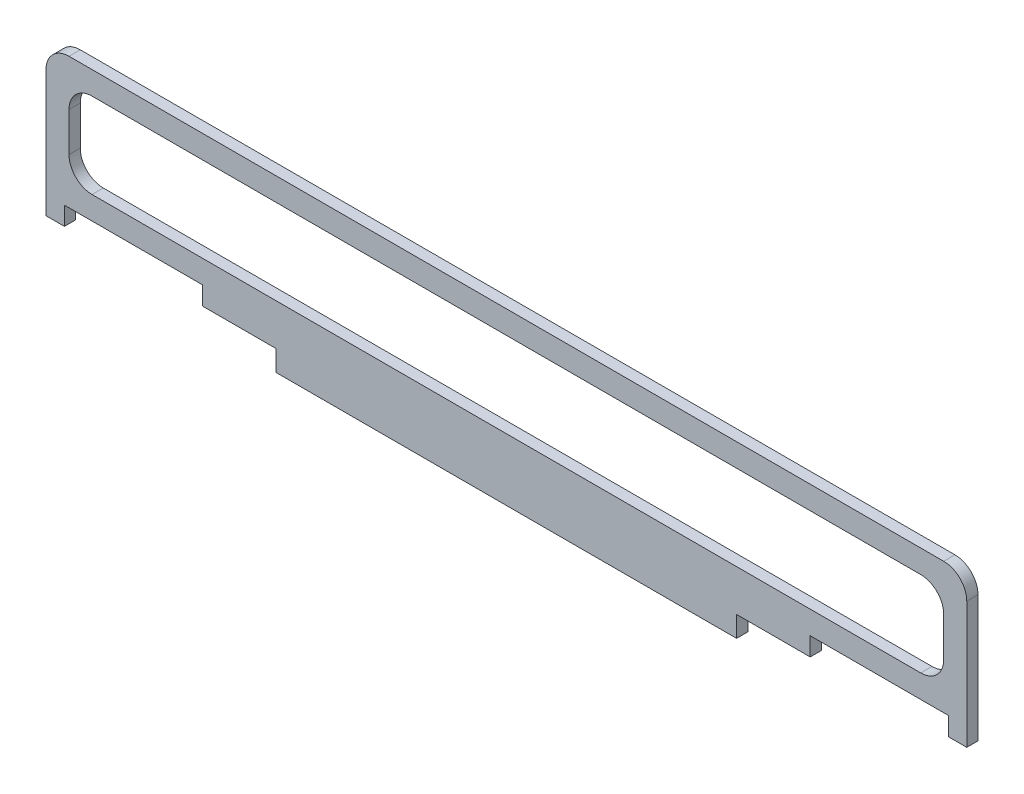
from build123d import *

# Parameters (mm, degrees)
SKETCH1_W           = 254
SKETCH1_H           = 46.99
BOSS_EXTRUDE1_DEPTH = 3.0988
FILLET1_R           = 6.35
SKETCH2_W           = 63.5
SKETCH2_H           = 5.715
CUT_EXTRUDE1_DEPTH  = 130.192173085
SKETCH3_W           = 38.1
SKETCH3_H           = 5.08
CUT_EXTRUDE2_DEPTH  = 130.192173085
CUT_EXTRUDE3_DEPTH  = 130.192173085
FILLET2_R           = 6.35


with BuildPart() as part:
    # Sketch1 → Boss-Extrude1 (new body)
    with BuildSketch(Plane.XY):
        Rectangle(SKETCH1_W, SKETCH1_H)
    extrude(amount=BOSS_EXTRUDE1_DEPTH)

    # Fillet1
    fillet1_edges = [part.edges().sort_by_distance(p)[0] for p in [
        (127, 23.495, 1.5494),
        (-127, 23.495, 1.5494),
    ]]
    fillet(fillet1_edges, radius=FILLET1_R)

    # Sketch2 → Cut-Extrude1 (cut, through all)
    with BuildSketch(Plane.XY.offset(3.0988)):
        with Locations((-95.25, -20.6375)):
            Rectangle(SKETCH2_W, SKETCH2_H)
        with Locations((95.25, -20.6375)):
            Rectangle(SKETCH2_W, SKETCH2_H)
    extrude(amount=-CUT_EXTRUDE1_DEPTH, mode=Mode.SUBTRACT)

    # Sketch3 → Cut-Extrude2 (cut, through all)
    with BuildSketch(Plane.XY.offset(3.0988)):
        with Locations((-102.87, -15.24)):
            Rectangle(SKETCH3_W, SKETCH3_H)
        with Locations((102.87, -15.24)):
            Rectangle(SKETCH3_W, SKETCH3_H)
    extrude(amount=-CUT_EXTRUDE2_DEPTH, mode=Mode.SUBTRACT)

    # Sketch4 → Cut-Extrude3 (cut, through all)
    with BuildSketch(Plane.XY.offset(3.0988)):
        Polygon((-77.47, -6.35), (77.47, -6.35), (120.65, -6.35), (120.65, 17.145), (-120.65, 17.145), (-120.65, -6.35), align=None)
    extrude(amount=-CUT_EXTRUDE3_DEPTH, mode=Mode.SUBTRACT)

    # Fillet2
    fillet2_edges = [part.edges().sort_by_distance(p)[0] for p in [
        (120.65, -6.35, 1.5494),
        (120.65, 17.145, 1.5494),
        (-120.65, 17.145, 1.5494),
        (-120.65, -6.35, 1.5494),
    ]]
    fillet(fillet2_edges, radius=FILLET2_R)


solid = part.part
